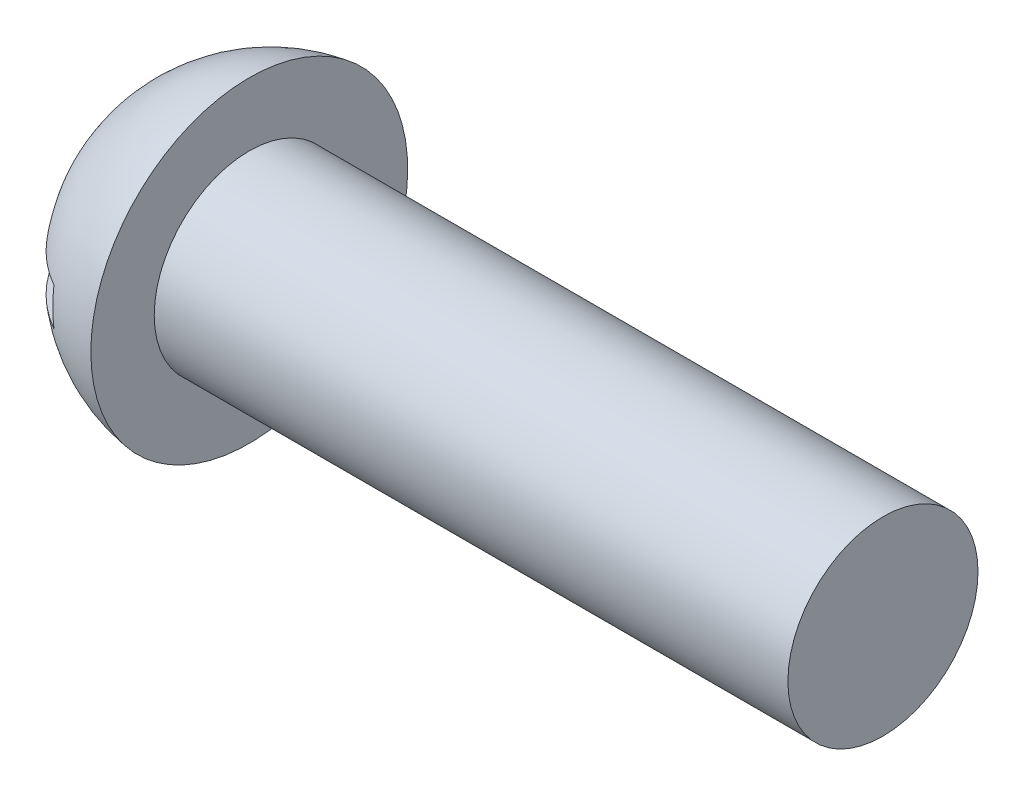
from build123d import *

# Parameters (mm, degrees)
SKETCH2_W         = 31.75
SKETCH2_H         = 3.7846
SLOT_DEPTH        = 8.128
CIRPATTERN1_COUNT = 2
CIRPATTERN1_ANGLE = 90


# Read off the part's stored shape, not the designer's step: ThreadSchematic
with BuildPart() as part:
    # ThreadSchematic outline → ThreadSchematic (revolve)
    with BuildSketch(Plane.YX):
        with BuildLine():
            Line((0, 77.3938), (0, 0))
            ThreePointArc((0, 0), (10.548143245, 3.963989534), (15.875000001, 13.893800008))
            Line((15.875000001, 13.893800008), (9.525, 13.8938))
            Line((9.525, 13.8938), (9.525, 77.3938))
            Line((9.525, 77.3938), (0, 77.3938))
        make_face()
    revolve(axis=Axis((0, 0, 0), (1, 0, 0)))

    # Sketch2 → Slot (cut)
    with BuildSketch(Plane(origin=(0, 0, 0), x_dir=(0, 0, -1), z_dir=(1, 0, 0))):
        Rectangle(SKETCH2_W, SKETCH2_H)
    extrude(amount=SLOT_DEPTH, mode=Mode.SUBTRACT)

    # Sketch3 → Cross section 0
    with BuildSketch(Plane(origin=(0, 0, 0), x_dir=(0, 0, -1), z_dir=(1, 0, 0))):
        with BuildLine():
            Line((1.3081, -8.255), (-1.3081, -8.255))
            Line((-1.3081, -8.255), (-1.3081, 8.255))
            Line((-1.3081, 8.255), (1.3081, 8.255))
            Line((1.3081, 8.255), (1.3081, -8.255))
        make_face()
    # Sketch4 → Cross section 1
    with BuildSketch(Plane(origin=(10.0838, 0, 0), x_dir=(0, 0, -1), z_dir=(1, 0, 0))):
        with BuildLine():
            Line((0.65405, -0.65405), (-0.65405, -0.65405))
            Line((-0.65405, -0.65405), (-0.65405, 0.65405))
            Line((-0.65405, 0.65405), (0.65405, 0.65405))
            Line((0.65405, 0.65405), (0.65405, -0.65405))
        make_face()
    cross = loft(mode=Mode.SUBTRACT)

    # CirPattern1: Cross ×2 about axis
    cirpattern1_axis = Axis((0, 0, 0), (1, 0, 0))
    for i in range(1, CIRPATTERN1_COUNT):
        add(cross.rotate(cirpattern1_axis, i * CIRPATTERN1_ANGLE / (CIRPATTERN1_COUNT - 1)), mode=Mode.SUBTRACT)


solid = part.part
